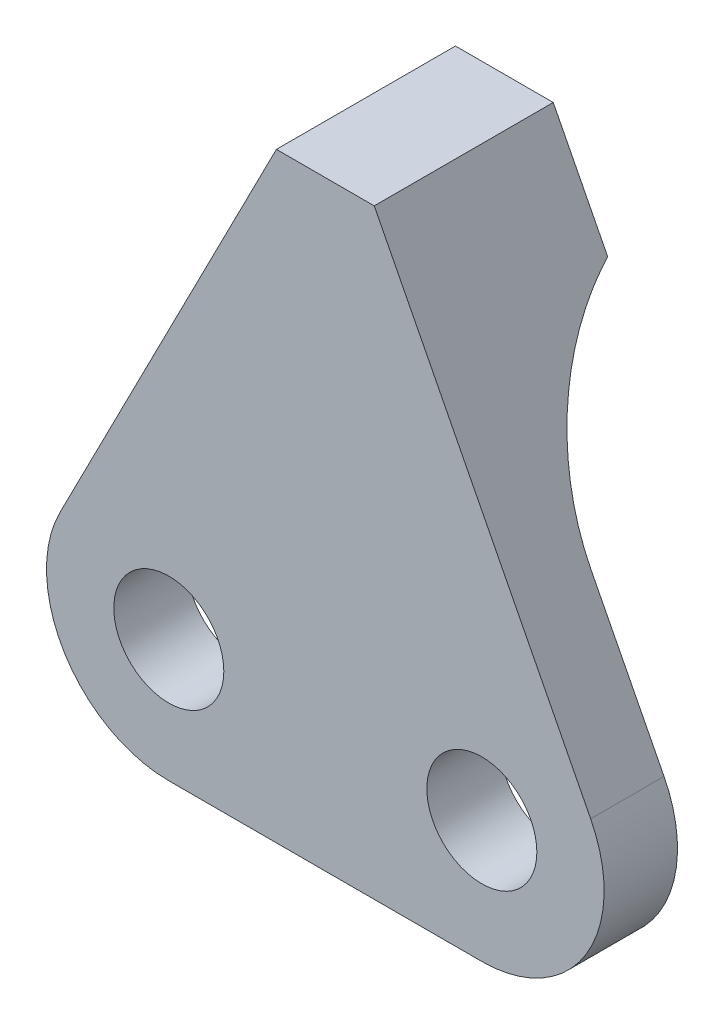
from build123d import *

# Parameters (mm, degrees)
BOSS_EXTRUDE1_DEPTH     = 4.7625
F_1_4_CLEARANCE_HOLE1_D = 7.14248
BOSS_EXTRUDE2_DEPTH     = 6.858
DRAFT1_ANGLE            = 30
FILLET1_R               = 12.7


with BuildPart() as part:
    # Sketch1 → Boss-Extrude1 (new body)
    with BuildSketch(Plane.XY):
        with BuildLine():
            Line((0, -7.9375), (20.32, -7.9375))
            ThreePointArc((20.32, -7.9375), (27.092168365, -4.140246597), (27.38480555, 3.61834614))
            Line((27.38480555, 3.61834614), (13.335, 31.050532116))
            Line((13.335, 31.050532116), (6.985, 31.050532116))
            Line((6.985, 31.050532116), (-7.06480555, 3.61834614))
            ThreePointArc((-7.06480555, 3.61834614), (-6.772168365, -4.140246597), (0, -7.9375))
        make_face()
    extrude(amount=BOSS_EXTRUDE1_DEPTH)

    # 1/4 Clearance Hole1 (through all)
    with Locations(Plane.XY.offset(4.7625)):
        with Locations((0, 0), (20.32, 0)):
            Hole(F_1_4_CLEARANCE_HOLE1_D / 2)

    # Sketch6 → Boss-Extrude2 (add)
    with BuildSketch(Plane(origin=(0, 0, 0), x_dir=(-1, 0, 0), z_dir=(0, 0, -1))):
        Polygon((-16.866941061, 24.154432116), (-3.453058939, 24.154432116), (-6.985, 31.050532116), (-13.335, 31.050532116), align=None)
    extrude(amount=BOSS_EXTRUDE2_DEPTH)

    # Draft1
    draft1_faces = [part.faces().sort_by_distance(p)[0] for p in [
        (10.16, 24.154432116, -3.429),
    ]]
    draft(draft1_faces, Plane(origin=(0, 0, -6.858), x_dir=(-1, 0, 0), z_dir=(0, 0, -1)), DRAFT1_ANGLE)

    # Fillet1
    fillet1_edges = [part.edges().sort_by_distance(p)[0] for p in [
        (10.16, 20.19496397, 0),
    ]]
    fillet(fillet1_edges, radius=FILLET1_R)


solid = part.part
